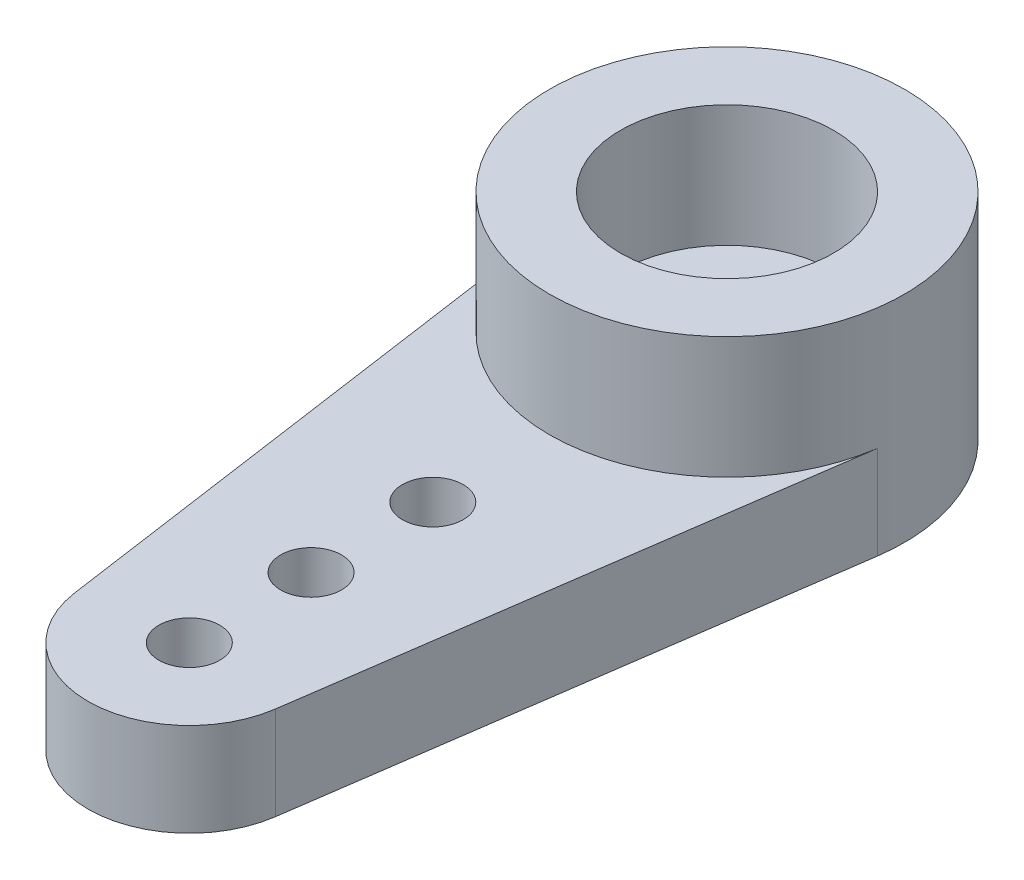
from build123d import *
from build123d.topology import SkipClean

# Parameters (mm, degrees)
SKETCH1_R           = 4.375
SKETCH1_R_2         = 2.625
BOSS_EXTRUDE1_DEPTH = 3
BOSS_EXTRUDE2_START = 2.3
SKETCH2_R           = 1.425
SKETCH2_R_2         = 0.75
BOSS_EXTRUDE2_DEPTH = 2.3


with BuildPart() as part:
    # Sketch1 → Boss-Extrude1 (new body)
    with BuildSketch(Plane(origin=(0, 0, 0), x_dir=(1, 0, 0), z_dir=(0, 1, 0))):
        Circle(SKETCH1_R)
        Circle(SKETCH1_R_2, mode=Mode.SUBTRACT)
    extrude(amount=BOSS_EXTRUDE1_DEPTH)

    # Sketch2 → Boss-Extrude2 (add)
    with SkipClean():  # the faces are left unmerged after this step: merging them gives an invalid solid
        with BuildSketch(Plane.XZ.offset(BOSS_EXTRUDE2_START)):
            with BuildLine():
                Line((-2.474842268, 13.603773585), (-4.330973969, 0.619103774))
                ThreePointArc((-4.330973969, 0.619103774), (0, -4.375), (4.330973969, 0.619103774))
                Line((4.330973969, 0.619103774), (2.474842268, 13.603773585))
                ThreePointArc((2.474842268, 13.603773585), (0, 15.75), (-2.474842268, 13.603773585))
            make_face()
            Circle(SKETCH2_R, mode=Mode.SUBTRACT)
            with Locations((0, 13.25)):
                Circle(SKETCH2_R_2, mode=Mode.SUBTRACT)
            with Locations((0, 10.25)):
                Circle(SKETCH2_R_2, mode=Mode.SUBTRACT)
            with Locations((0, 7.25)):
                Circle(SKETCH2_R_2, mode=Mode.SUBTRACT)
        extrude(amount=-BOSS_EXTRUDE2_DEPTH)


solid = part.part
